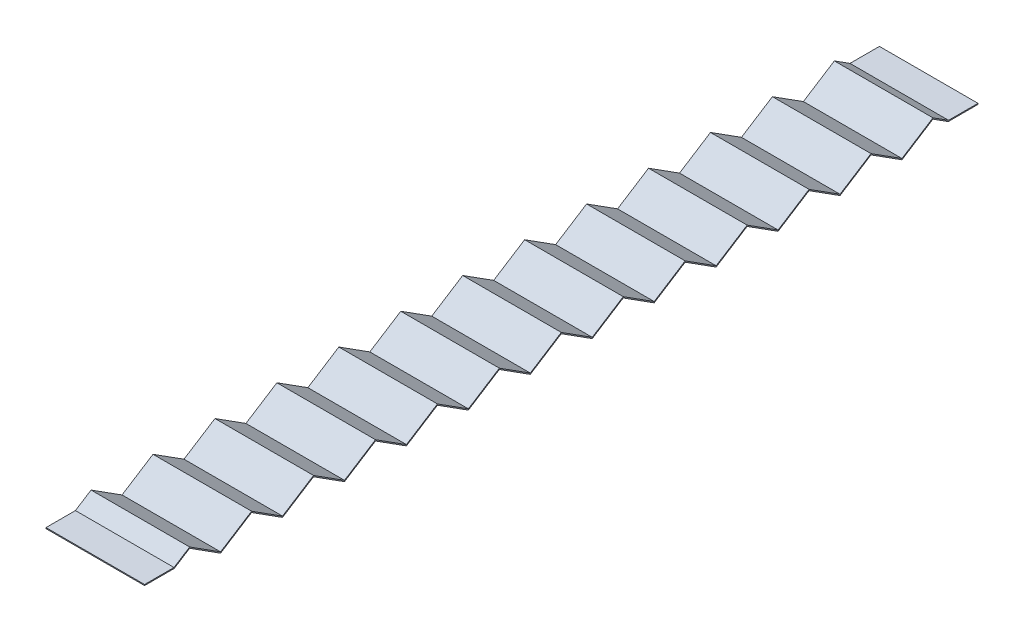
from build123d import *

# Parameters (mm, degrees)
EXTRUDE_THIN1_DEPTH = 25


with BuildPart() as part:
    # Sketch3 → Extrude-Thin1 (new, symmetric)
    with BuildSketch(Plane(origin=(0, 0, 0), x_dir=(0, 0, -1), z_dir=(1, 0, 0))):
        Polygon((0, 4.75), (15.072825095, 4.75), (22.853955515, 9.70363795), (38.561866545, -0.29636205), (54.269777576, 9.70363795), (69.977688606, -0.29636205), (85.685599636, 9.70363795), (101.393510666, -0.29636205), (117.101421697, 9.70363795), (132.809332727, -0.29636205), (148.517243757, 9.70363795), (164.225154787, -0.29636205), (179.933065818, 9.70363795), (195.640976848, -0.29636205), (211.348887878, 9.70363795), (227.056798908, -0.29636205), (242.764709938, 9.70363795), (258.472620969, -0.29636205), (274.180531999, 9.70363795), (289.888443029, -0.29636205), (305.596354059, 9.70363795), (321.30426509, -0.29636205), (337.01217612, 9.70363795), (352.72008715, -0.29636205), (368.42799818, 9.70363795), (384.135909211, -0.29636205), (399.843820241, 9.70363795), (407.624950661, 4.75), (422.697775756, 4.75), (422.697775756, 5.25), (407.770600851, 5.25), (399.843820241, 10.29636205), (384.135909211, 0.29636205), (368.42799818, 10.29636205), (352.72008715, 0.29636205), (337.01217612, 10.29636205), (321.30426509, 0.29636205), (305.596354059, 10.29636205), (289.888443029, 0.29636205), (274.180531999, 10.29636205), (258.472620969, 0.29636205), (242.764709938, 10.29636205), (227.056798908, 0.29636205), (211.348887878, 10.29636205), (195.640976848, 0.29636205), (179.933065818, 10.29636205), (164.225154787, 0.29636205), (148.517243757, 10.29636205), (132.809332727, 0.29636205), (117.101421697, 10.29636205), (101.393510666, 0.29636205), (85.685599636, 10.29636205), (69.977688606, 0.29636205), (54.269777576, 10.29636205), (38.561866545, 0.29636205), (22.853955515, 10.29636205), (14.927174905, 5.25), (0, 5.25), align=None)
    extrude(amount=EXTRUDE_THIN1_DEPTH, both=True)


solid = part.part
